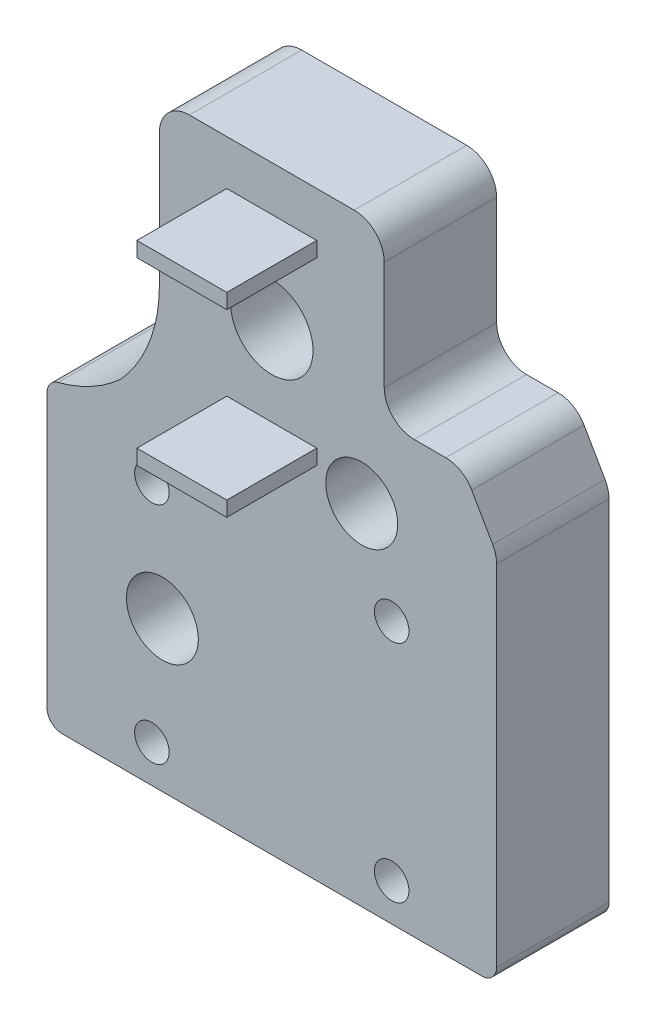
from build123d import *

# Parameters (mm, degrees)
SKETCH_1_W                   = 30
SKETCH_1_H                   = 20
EXTRUDE_1_DEPTH              = 7.5
SKETCH_5_W                   = 15
SKETCH_5_H                   = 7.5
EXTRUDE_2_DEPTH              = 17.5
SKETCH_6_W                   = 6
SKETCH_6_H                   = 1
EXTRUDE_3_DEPTH              = 6
HOLE_WIZARD_M6_1_D           = 5.5
HOLE_WIZARD_M6_1_CSINK_D     = 11.5
HOLE_WIZARD_M6_1_CSINK_ANGLE = 90
F_4_0MM_1_D                  = 4.8
F_4_0MM_1_DEPTH              = 7.5
F_4_0MM_1_TIP                = 1.442065486
EXTRUDE_4_DEPTH              = 7.5
F_4_0MM_2_D                  = 4.8
EXTRUDE_5_DEPTH              = 7.5
FILLET_1_R                   = 10
MOVE_BODY_1_OUTLINE_R        = 2.4
MOVE_BODY_1_OUTLINE_W        = 6
MOVE_BODY_1_OUTLINE_H        = 1
MOVE_BODY_1_OUTLINE_R_2      = 2.75
MOVE_BODY_1_DEPTH            = 7.5
MOVE_START                   = 6
MOVE_BODY_1_2_OUTLINE_W      = 6
MOVE_BODY_1_2_OUTLINE_H      = 1
MOVE_BODY_1_2_DEPTH          = 1.5
MOVE_START_2                 = -6.1500001
MOVE_BODY_1_3_OUTLINE_R      = 1.65
MOVE_BODY_1_3_OUTLINE_R_2    = 2.4
MOVE_BODY_1_3_OUTLINE_R_3    = 2.75
MOVE_BODY_1_3_DEPTH          = 6.1500001
MOVE_START_3                 = -7.5
MOVE_BODY_1_4_DEPTH          = 1.5
MOVE_BODY_1_5_OUTLINE_R      = 2.4
MOVE_BODY_1_5_OUTLINE_R_2    = 2.75
MOVE_BODY_1_5_DEPTH          = 1.3499999
MOVE_START_4                 = -0.3000001
MOVE_BODY_1_6_OUTLINE_R      = 2.4
MOVE_BODY_1_6_OUTLINE_R_2    = 2.75
MOVE_BODY_1_6_DEPTH          = 0.3000001
SKETCH_28_W                  = 15
SKETCH_28_H                  = 7.5
EXTRUDE_6_DEPTH              = 2.5
CUT_EXTRUDE_START            = -8
CUT_EXTRUDE_1_DEPTH          = 9
CUT_EXTRUDE_START_2          = -1
CUT_EXTRUDE_1_2_OUTLINE_R    = 2.5
CUT_EXTRUDE_1_2_OUTLINE_R_2  = 2.4
CUT_EXTRUDE_1_2_DEPTH        = 2


with BuildPart() as part:
    # 草图1 → 凸台-拉伸1 (new body)
    with BuildSketch(Plane.XY):
        Rectangle(SKETCH_1_W, SKETCH_1_H)
    extrude(amount=EXTRUDE_1_DEPTH)

    # 草图5 → 凸台-拉伸2 (add)
    with BuildSketch(Plane(origin=(0, 10, 0), x_dir=(1, 0, 0), z_dir=(0, 1, 0))):
        with Locations((0, -3.75)):
            Rectangle(SKETCH_5_W, SKETCH_5_H)
    extrude(amount=EXTRUDE_2_DEPTH)

    # 草图6 → 凸台-拉伸3 (add)
    with BuildSketch(Plane(origin=(0, 0, 0), x_dir=(-1, 0, 0), z_dir=(0, 0, -1))):
        with Locations((0, 26.5)):
            Rectangle(SKETCH_6_W, SKETCH_6_H)
        with Locations((0, 14.5)):
            Rectangle(SKETCH_6_W, SKETCH_6_H)
    extrude(amount=EXTRUDE_3_DEPTH)

    # M6 内六角花形半沉头螺钉的锥形沉头孔1 (through all)
    with Locations(Plane.XY.offset(7.5)):
        with Locations((0, 20.5)):
            CounterSinkHole(HOLE_WIZARD_M6_1_D / 2, HOLE_WIZARD_M6_1_CSINK_D / 2, counter_sink_angle=HOLE_WIZARD_M6_1_CSINK_ANGLE)

    # Ø4.0mm 暗销孔1
    with Locations(Plane.XY.offset(7.5)):
        with Locations((-7.3, 0)):
            Hole(F_4_0MM_1_D / 2, depth=F_4_0MM_1_DEPTH)
            with Locations((0, 0, -(F_4_0MM_1_DEPTH + F_4_0MM_1_TIP / 2))):  # 118° drill point
                Cone(0, F_4_0MM_1_D / 2, F_4_0MM_1_TIP, mode=Mode.SUBTRACT)

    # 草图15 → 凸台-拉伸4 (add)
    with BuildSketch(Plane.XY.offset(7.5)):
        Polygon((7.5, 18.75), (12.762776139, 18.75), (15, 14.845537246), (15, 10), (7.5, 10), align=None)
    extrude(amount=-EXTRUDE_4_DEPTH)

    # Ø4.0mm 暗销孔2 (through all)
    with Locations(Plane.XY.offset(7.5)):
        with Locations((6, 13.3)):
            Hole(F_4_0MM_2_D / 2)

    # 草图23 → 凸台-拉伸5 (add)
    with BuildSketch(Plane.XY.offset(7.5)):
        Polygon((-7.5, 15), (-12.5, 10), (-7.5, 10), align=None)
    extrude(amount=-EXTRUDE_5_DEPTH)

    # M6 内六角花形半沉头螺钉的锥形沉头孔3: read off the stored shape, not the designer's step
    # M6 内六角花形半沉头螺钉的锥形沉头孔3 outline → M6 内六角花形半沉头螺钉的锥形沉头孔3 (revolve, cut)
    with BuildSketch(Plane(origin=(-8, 7.5, 0), x_dir=(1, 0, 0), z_dir=(0, -1, 0))):
        Polygon((0, 7.5), (0, 0), (1.150716155, 0), (1.65, 0.3), (1.65, 6.15), (3, 7.5), align=None)
    hole_wizard_m6_3 = revolve(axis=Axis((-8, 7.5, 0), (0, 0, 1)), mode=Mode.SUBTRACT)

    # 镜向3: M6 内六角花形半沉头螺钉的锥形沉头孔3 across plane
    add(hole_wizard_m6_3.mirror(Plane.ZX), mode=Mode.SUBTRACT)

    # 镜向3 at the second plane: M6 内六角花形半沉头螺钉的锥形沉头孔3 across plane
    add(hole_wizard_m6_3.mirror(Plane(origin=(0, 0, 0), x_dir=(0, 0, 1), z_dir=(1, 0, 0))), mode=Mode.SUBTRACT)

    # 镜向3 at the second plane copy 1 sket → 镜向3 at the second plane copy 1 (revolve, cut)
    with BuildSketch(Plane(origin=(8, -7.5, 0), x_dir=(-1, 0, 0), z_dir=(0, 1, 0))):
        Polygon((0, 7.5), (0, 0), (1.150716155, 0), (1.65, 0.3), (1.65, 6.15), (3, 7.5), align=None)
    revolve(axis=Axis((8, -7.5, 0), (0, 0, 1)), mode=Mode.SUBTRACT)

    # 圆角1
    # the kernel refuses this fillet: 10 mm, written as the material it adds along each edge
    with BuildSketch(Plane(origin=(-12.5, 10, 7.5), x_dir=(-1, 0, 0), z_dir=(0, 0, -1))) as fillet_1_piece_1:
        with BuildLine():
            CenterArc((4.306697434, 9.83543819), FILLET_1_R, 225, 34.591227114)
            Line((-2.764370378, 2.764370378), (-2.905791734, 2.622949022))
            Line((-2.905791734, 2.622949022), (-0.141421356, -0.141421356))
            Line((-0.141421356, -0.141421356), (0, -0.2))
            ThreePointArc((0, -0.2), (1.25, -0.2), (2.463866051, -0.196708764))
            Line((2.463866051, -0.196708764), (2.5, 0))
        make_face()
    extrude(amount=7.5)
    with BuildSketch(Plane(origin=(-7.5, 15, 7.5), x_dir=(-0.7071067811865475, -0.7071067811865477, 0), z_dir=(0, 0, -1))) as fillet_1_piece_2:
        with BuildLine():
            CenterArc((FILLET_1_R * 0.414213562373, FILLET_1_R), FILLET_1_R, 225, 45)
            Line((-FILLET_1_R * 0.292893218813, FILLET_1_R * 0.292893218813), (-FILLET_1_R * 0.307035354437, FILLET_1_R * 0.27875108319))
            Line((-FILLET_1_R * 0.307035354437, FILLET_1_R * 0.27875108319), (-FILLET_1_R * 0.00828427124746, -FILLET_1_R * 0.02))
            Line((-FILLET_1_R * 0.00828427124746, -FILLET_1_R * 0.02), (FILLET_1_R * 0.414213562373, -FILLET_1_R * 0.02))
            Line((FILLET_1_R * 0.414213562373, -FILLET_1_R * 0.02), (FILLET_1_R * 0.414213562373, 0))
        make_face()
    extrude(amount=7.5)

    # Move Body 1: read off the stored shape, not the designer's step
    # Move Body 1 outline → Move Body 1 (cut)
    with BuildSketch(Plane.XY):
        with BuildLine():
            Line((-15, -10), (15, -10))
            Line((15, -10), (15, 14.845537246))
            Line((15, 14.845537246), (14.73531678, 15.307469462))
            Line((14.73531678, 15.307469462), (13.33902122, 17.744321716))
            Line((13.33902122, 17.744321716), (12.762776139, 18.75))
            Line((12.762776139, 18.75), (7.5, 18.75))
            Line((7.5, 18.75), (7.5, 27.5))
            Line((7.5, 27.5), (-7.5, 27.5))
            Line((-7.5, 27.5), (-7.5, 19.142135624))
            ThreePointArc((-7.5, 19.142135624), (-8.170150889, 15.542980782), (-10.090783115, 12.426221304))
            ThreePointArc((-10.090783115, 12.426221304), (-12.037200533, 11.046132226), (-14.255154312, 10.166434741))
            ThreePointArc((-14.255154312, 10.166434741), (-14.625988761, 10.076108823), (-15, 10))
            Line((-15, 10), (-15, -10))
        make_face()
        with Locations((-7.3, 0)):
            Circle(MOVE_BODY_1_OUTLINE_R, mode=Mode.SUBTRACT)
        with Locations((6, 13.3)):
            Circle(MOVE_BODY_1_OUTLINE_R, mode=Mode.SUBTRACT)
        with Locations((0, 14.5)):
            Rectangle(MOVE_BODY_1_OUTLINE_W, MOVE_BODY_1_OUTLINE_H, mode=Mode.SUBTRACT)
        with Locations((0, 20.5)):
            Circle(MOVE_BODY_1_OUTLINE_R_2, mode=Mode.SUBTRACT)
        with Locations((0, 26.5)):
            Rectangle(MOVE_BODY_1_OUTLINE_W, MOVE_BODY_1_OUTLINE_H, mode=Mode.SUBTRACT)
    extrude(amount=MOVE_BODY_1_DEPTH, mode=Mode.SUBTRACT)

    # Move Body 1 2 outline → Move Body 1 2 (cut)
    with BuildSketch(Plane.XY.offset(MOVE_START)):
        with Locations((0, 14.5)):
            Rectangle(MOVE_BODY_1_2_OUTLINE_W, MOVE_BODY_1_2_OUTLINE_H)
        with Locations((0, 26.5)):
            Rectangle(MOVE_BODY_1_2_OUTLINE_W, MOVE_BODY_1_2_OUTLINE_H)
    extrude(amount=MOVE_BODY_1_2_DEPTH, mode=Mode.SUBTRACT)

    # Move Body 1 3 outline → Move Body 1 3 (add)
    with BuildSketch(Plane.XY.offset(MOVE_START_2)):
        with BuildLine():
            Line((-15, 9.199534396), (-15, -9))
            ThreePointArc((-15, -9), (-14.707106781, -9.707106781), (-14, -10))
            Line((-14, -10), (14, -10))
            ThreePointArc((14, -10), (14.707106781, -9.707106781), (15, -9))
            Line((15, -9), (15, 14.313147746))
            ThreePointArc((15, 14.313147746), (14.932696763, 14.827621477), (14.73531678, 15.307469462))
            Line((14.73531678, 15.307469462), (13.33902122, 17.744321716))
            ThreePointArc((13.33902122, 17.744321716), (12.606539563, 18.480410852), (11.60370444, 18.75))
            Line((11.60370444, 18.75), (9.5, 18.75))
            ThreePointArc((9.5, 18.75), (8.085786438, 19.335786438), (7.5, 20.75))
            Line((7.5, 20.75), (7.5, 27.5))
            Line((7.5, 27.5), (-7.5, 27.5))
            Line((-7.5, 27.5), (-7.5, 19.142135624))
            ThreePointArc((-7.5, 19.142135624), (-8.170150889, 15.542980782), (-10.090783115, 12.426221304))
            ThreePointArc((-10.090783115, 12.426221304), (-12.037200533, 11.046132226), (-14.255154312, 10.166434741))
            ThreePointArc((-14.255154312, 10.166434741), (-14.792197675, 9.809798965), (-15, 9.199534396))
        make_face()
        with Locations((-8, -7.5)):
            Circle(MOVE_BODY_1_3_OUTLINE_R, mode=Mode.SUBTRACT)
        with Locations((-8, 7.5)):
            Circle(MOVE_BODY_1_3_OUTLINE_R, mode=Mode.SUBTRACT)
        with Locations((-7.3, 0)):
            Circle(MOVE_BODY_1_3_OUTLINE_R_2, mode=Mode.SUBTRACT)
        with Locations((8, -7.5)):
            Circle(MOVE_BODY_1_3_OUTLINE_R, mode=Mode.SUBTRACT)
        with Locations((8, 7.5)):
            Circle(MOVE_BODY_1_3_OUTLINE_R, mode=Mode.SUBTRACT)
        with Locations((6, 13.3)):
            Circle(MOVE_BODY_1_3_OUTLINE_R_2, mode=Mode.SUBTRACT)
        with Locations((0, 20.5)):
            Circle(MOVE_BODY_1_3_OUTLINE_R_3, mode=Mode.SUBTRACT)
    extrude(amount=MOVE_BODY_1_3_DEPTH)

    # Move Body 1 4 outline → Move Body 1 4 (add)
    with BuildSketch(Plane.XY.offset(MOVE_START_3)):
        with BuildLine():
            ThreePointArc((9.5, 18.75), (8.085786438, 19.335786438), (7.5, 20.75))
            Line((7.5, 20.75), (7.5, 18.75))
            Line((7.5, 18.75), (9.5, 18.75))
        make_face()
    extrude(amount=MOVE_BODY_1_4_DEPTH)

    # Move Body 1 5 outline → Move Body 1 5 (add)
    with BuildSketch(Plane.XY.offset(MOVE_START_3)):
        with BuildLine():
            Line((-15, 9.199534396), (-15, -9))
            ThreePointArc((-15, -9), (-14.707106781, -9.707106781), (-14, -10))
            Line((-14, -10), (14, -10))
            ThreePointArc((14, -10), (14.707106781, -9.707106781), (15, -9))
            Line((15, -9), (15, 14.313147746))
            ThreePointArc((15, 14.313147746), (14.932696763, 14.827621477), (14.73531678, 15.307469462))
            Line((14.73531678, 15.307469462), (13.33902122, 17.744321716))
            ThreePointArc((13.33902122, 17.744321716), (12.606539563, 18.480410852), (11.60370444, 18.75))
            Line((11.60370444, 18.75), (7.5, 18.75))
            Line((7.5, 18.75), (7.5, 27.5))
            Line((7.5, 27.5), (-7.5, 27.5))
            Line((-7.5, 27.5), (-7.5, 19.142135624))
            ThreePointArc((-7.5, 19.142135624), (-8.170150889, 15.542980782), (-10.090783115, 12.426221304))
            ThreePointArc((-10.090783115, 12.426221304), (-12.037200533, 11.046132226), (-14.255154312, 10.166434741))
            ThreePointArc((-14.255154312, 10.166434741), (-14.792197675, 9.809798965), (-15, 9.199534396))
        make_face()
        with Locations((-7.3, 0)):
            Circle(MOVE_BODY_1_5_OUTLINE_R, mode=Mode.SUBTRACT)
        with Locations((6, 13.3)):
            Circle(MOVE_BODY_1_5_OUTLINE_R, mode=Mode.SUBTRACT)
        with Locations((0, 20.5)):
            Circle(MOVE_BODY_1_5_OUTLINE_R_2, mode=Mode.SUBTRACT)
    extrude(amount=MOVE_BODY_1_5_DEPTH)

    # Move Body 1 6 outline → Move Body 1 6 (add)
    with BuildSketch(Plane.XY.offset(MOVE_START_4)):
        with BuildLine():
            Line((-15, 9.199534396), (-15, -9))
            ThreePointArc((-15, -9), (-14.707106781, -9.707106781), (-14, -10))
            Line((-14, -10), (14, -10))
            ThreePointArc((14, -10), (14.707106781, -9.707106781), (15, -9))
            Line((15, -9), (15, 14.313147746))
            ThreePointArc((15, 14.313147746), (14.932696763, 14.827621477), (14.73531678, 15.307469462))
            Line((14.73531678, 15.307469462), (13.33902122, 17.744321716))
            ThreePointArc((13.33902122, 17.744321716), (12.606539563, 18.480410852), (11.60370444, 18.75))
            Line((11.60370444, 18.75), (7.5, 18.75))
            Line((7.5, 18.75), (7.5, 27.5))
            Line((7.5, 27.5), (-7.5, 27.5))
            Line((-7.5, 27.5), (-7.5, 19.142135624))
            ThreePointArc((-7.5, 19.142135624), (-8.170150889, 15.542980782), (-10.090783115, 12.426221304))
            ThreePointArc((-10.090783115, 12.426221304), (-12.037200533, 11.046132226), (-14.255154312, 10.166434741))
            ThreePointArc((-14.255154312, 10.166434741), (-14.792197675, 9.809798965), (-15, 9.199534396))
        make_face()
        with Locations((-7.3, 0)):
            Circle(MOVE_BODY_1_6_OUTLINE_R, mode=Mode.SUBTRACT)
        with Locations((6, 13.3)):
            Circle(MOVE_BODY_1_6_OUTLINE_R, mode=Mode.SUBTRACT)
        with Locations((0, 20.5)):
            Circle(MOVE_BODY_1_6_OUTLINE_R_2, mode=Mode.SUBTRACT)
    extrude(amount=MOVE_BODY_1_6_DEPTH)

    # Move Body 1 7: loft between two sections, ruled curve by curve
    move_body_1_7_from = [
        Edge.make_three_point_arc((2.75, 20.5, -4.5), (0, 17.75, -4.5), (-2.75, 20.5, -4.5)),
        Edge.make_three_point_arc((-2.75, 20.5, -4.5), (0, 23.25, -4.5), (2.75, 20.5, -4.5)),
    ]
    move_body_1_7_to = [
        Edge.make_three_point_arc((5.75, 20.5, -7.5), (0, 14.75, -7.5), (-5.75, 20.5, -7.5)),
        Edge.make_three_point_arc((-5.75, 20.5, -7.5), (0, 26.25, -7.5), (5.75, 20.5, -7.5)),
    ]
    move_body_1_7 = Solid(Shell([*[Face.make_surface_from_curves(move_body_1_7_from[k], move_body_1_7_to[k]) for k in range(2)], Face(Wire(move_body_1_7_from)), Face(Wire(move_body_1_7_to))]))
    add(move_body_1_7, mode=Mode.SUBTRACT)

    # Move Body 1 8: loft between two sections, ruled curve by curve
    move_body_1_8_from = [
        Edge.make_three_point_arc((-6.849283845, 7.5, 0), (-8, 6.349283845, 0), (-9.150716155, 7.5, 0)),
        Edge.make_three_point_arc((-9.150716155, 7.5, 0), (-8, 8.650716155, 0), (-6.849283845, 7.5, 0)),
    ]
    move_body_1_8_to = [
        Edge.make_three_point_arc((-6.35, 7.5, -0.3), (-8, 5.85, -0.3), (-9.65, 7.5, -0.3)),
        Edge.make_three_point_arc((-9.65, 7.5, -0.3), (-8, 9.15, -0.3), (-6.35, 7.5, -0.3)),
    ]
    move_body_1_8 = Solid(Shell([*[Face.make_surface_from_curves(move_body_1_8_from[k], move_body_1_8_to[k]) for k in range(2)], Face(Wire(move_body_1_8_from)), Face(Wire(move_body_1_8_to))]))
    add(move_body_1_8, mode=Mode.SUBTRACT)

    # Move Body 1 9: loft between two sections, ruled curve by curve
    move_body_1_9_from = [
        Edge.make_three_point_arc((-6.35, 7.5, -6.15), (-8, 5.85, -6.15), (-9.65, 7.5, -6.15)),
        Edge.make_three_point_arc((-9.65, 7.5, -6.15), (-8, 9.15, -6.15), (-6.35, 7.5, -6.15)),
    ]
    move_body_1_9_to = [
        Edge.make_three_point_arc((-5, 7.5, -7.5), (-8, 4.5, -7.5), (-11, 7.5, -7.5)),
        Edge.make_three_point_arc((-11, 7.5, -7.5), (-8, 10.5, -7.5), (-5, 7.5, -7.5)),
    ]
    move_body_1_9 = Solid(Shell([*[Face.make_surface_from_curves(move_body_1_9_from[k], move_body_1_9_to[k]) for k in range(2)], Face(Wire(move_body_1_9_from)), Face(Wire(move_body_1_9_to))]))
    add(move_body_1_9, mode=Mode.SUBTRACT)

    # Move Body 1 10: loft between two sections, ruled curve by curve
    move_body_1_10_from = [
        Edge.make_three_point_arc((9.150716155, 7.5, 0), (8, 6.349283845, 0), (6.849283845, 7.5, 0)),
        Edge.make_three_point_arc((6.849283845, 7.5, 0), (8, 8.650716155, 0), (9.150716155, 7.5, 0)),
    ]
    move_body_1_10_to = [
        Edge.make_three_point_arc((9.65, 7.5, -0.3), (8, 5.85, -0.3), (6.35, 7.5, -0.3)),
        Edge.make_three_point_arc((6.35, 7.5, -0.3), (8, 9.15, -0.3), (9.65, 7.5, -0.3)),
    ]
    move_body_1_10 = Solid(Shell([*[Face.make_surface_from_curves(move_body_1_10_from[k], move_body_1_10_to[k]) for k in range(2)], Face(Wire(move_body_1_10_from)), Face(Wire(move_body_1_10_to))]))
    add(move_body_1_10, mode=Mode.SUBTRACT)

    # Move Body 1 11: loft between two sections, ruled curve by curve
    move_body_1_11_from = [
        Edge.make_three_point_arc((9.65, 7.5, -6.15), (8, 5.85, -6.15), (6.35, 7.5, -6.15)),
        Edge.make_three_point_arc((6.35, 7.5, -6.15), (8, 9.15, -6.15), (9.65, 7.5, -6.15)),
    ]
    move_body_1_11_to = [
        Edge.make_three_point_arc((11, 7.5, -7.5), (8, 4.5, -7.5), (5, 7.5, -7.5)),
        Edge.make_three_point_arc((5, 7.5, -7.5), (8, 10.5, -7.5), (11, 7.5, -7.5)),
    ]
    move_body_1_11 = Solid(Shell([*[Face.make_surface_from_curves(move_body_1_11_from[k], move_body_1_11_to[k]) for k in range(2)], Face(Wire(move_body_1_11_from)), Face(Wire(move_body_1_11_to))]))
    add(move_body_1_11, mode=Mode.SUBTRACT)

    # Move Body 1 12: loft between two sections, ruled curve by curve
    move_body_1_12_from = [
        Edge.make_three_point_arc((-6.849283845, -7.5, 0), (-8, -8.650716155, 0), (-9.150716155, -7.5, 0)),
        Edge.make_three_point_arc((-9.150716155, -7.5, 0), (-8, -6.349283845, 0), (-6.849283845, -7.5, 0)),
    ]
    move_body_1_12_to = [
        Edge.make_three_point_arc((-6.35, -7.5, -0.3), (-8, -9.15, -0.3), (-9.65, -7.5, -0.3)),
        Edge.make_three_point_arc((-9.65, -7.5, -0.3), (-8, -5.85, -0.3), (-6.35, -7.5, -0.3)),
    ]
    move_body_1_12 = Solid(Shell([*[Face.make_surface_from_curves(move_body_1_12_from[k], move_body_1_12_to[k]) for k in range(2)], Face(Wire(move_body_1_12_from)), Face(Wire(move_body_1_12_to))]))
    add(move_body_1_12, mode=Mode.SUBTRACT)

    # Move Body 1 13: loft between two sections, ruled curve by curve
    move_body_1_13_from = [
        Edge.make_three_point_arc((-6.35, -7.5, -6.15), (-8, -9.15, -6.15), (-9.65, -7.5, -6.15)),
        Edge.make_three_point_arc((-9.65, -7.5, -6.15), (-8, -5.85, -6.15), (-6.35, -7.5, -6.15)),
    ]
    move_body_1_13_to = [
        Edge.make_three_point_arc((-5, -7.5, -7.5), (-8, -10.5, -7.5), (-11, -7.5, -7.5)),
        Edge.make_three_point_arc((-11, -7.5, -7.5), (-8, -4.5, -7.5), (-5, -7.5, -7.5)),
    ]
    move_body_1_13 = Solid(Shell([*[Face.make_surface_from_curves(move_body_1_13_from[k], move_body_1_13_to[k]) for k in range(2)], Face(Wire(move_body_1_13_from)), Face(Wire(move_body_1_13_to))]))
    add(move_body_1_13, mode=Mode.SUBTRACT)

    # Move Body 1 14: loft between two sections, ruled curve by curve
    move_body_1_14_from = [
        Edge.make_three_point_arc((9.150716155, -7.5, 0), (8, -8.650716155, 0), (6.849283845, -7.5, 0)),
        Edge.make_three_point_arc((6.849283845, -7.5, 0), (8, -6.349283845, 0), (9.150716155, -7.5, 0)),
    ]
    move_body_1_14_to = [
        Edge.make_three_point_arc((9.65, -7.5, -0.3), (8, -9.15, -0.3), (6.35, -7.5, -0.3)),
        Edge.make_three_point_arc((6.35, -7.5, -0.3), (8, -5.85, -0.3), (9.65, -7.5, -0.3)),
    ]
    move_body_1_14 = Solid(Shell([*[Face.make_surface_from_curves(move_body_1_14_from[k], move_body_1_14_to[k]) for k in range(2)], Face(Wire(move_body_1_14_from)), Face(Wire(move_body_1_14_to))]))
    add(move_body_1_14, mode=Mode.SUBTRACT)

    # Move Body 1 15: loft between two sections, ruled curve by curve
    move_body_1_15_from = [
        Edge.make_three_point_arc((9.65, -7.5, -6.15), (8, -9.15, -6.15), (6.35, -7.5, -6.15)),
        Edge.make_three_point_arc((6.35, -7.5, -6.15), (8, -5.85, -6.15), (9.65, -7.5, -6.15)),
    ]
    move_body_1_15_to = [
        Edge.make_three_point_arc((11, -7.5, -7.5), (8, -10.5, -7.5), (5, -7.5, -7.5)),
        Edge.make_three_point_arc((5, -7.5, -7.5), (8, -4.5, -7.5), (11, -7.5, -7.5)),
    ]
    move_body_1_15 = Solid(Shell([*[Face.make_surface_from_curves(move_body_1_15_from[k], move_body_1_15_to[k]) for k in range(2)], Face(Wire(move_body_1_15_from)), Face(Wire(move_body_1_15_to))]))
    add(move_body_1_15, mode=Mode.SUBTRACT)

    # 草图28 → 凸台-拉伸6 (add)
    with BuildSketch(Plane(origin=(0, 27.5, 0), x_dir=(1, 0, 0), z_dir=(0, 1, 0))):
        with Locations((0, 3.75)):
            Rectangle(SKETCH_28_W, SKETCH_28_H)
    extrude(amount=EXTRUDE_6_DEPTH)

    # 切除-拉伸1: read off the stored shape, not the designer's step
    # 切除-拉伸1 outline → 切除-拉伸1 (cut)
    with BuildSketch(Plane(origin=(0, 0, -7.5), x_dir=(-1, 0, 0), z_dir=(0, 0, -1)).offset(CUT_EXTRUDE_START)):
        with BuildLine():
            Line((-7.5, 30), (-7.5, 28))
            ThreePointArc((-7.5, 28), (-6.914213562, 29.414213562), (-5.5, 30))
            Line((-5.5, 30), (-7.5, 30))
        make_face()
        with BuildLine():
            Line((7.5, 30), (5.5, 30))
            ThreePointArc((5.5, 30), (6.914213562, 29.414213562), (7.5, 28))
            Line((7.5, 28), (7.5, 30))
        make_face()
    extrude(amount=CUT_EXTRUDE_1_DEPTH, mode=Mode.SUBTRACT)

    # Cut-Extrude 1 2 outline → Cut-Extrude 1 2 (cut)
    # profile 1 of 2: a face of its own
    with BuildSketch(Plane(origin=(0, 0, -7.5), x_dir=(-1, 0, 0), z_dir=(0, 0, -1)).offset(CUT_EXTRUDE_START_2)):
        with Locations((-6, 13.3)):
            Circle(CUT_EXTRUDE_1_2_OUTLINE_R)
        with Locations((-6, 13.3)):
            Circle(CUT_EXTRUDE_1_2_OUTLINE_R_2, mode=Mode.SUBTRACT)
    # profile 2 of 2: a face of its own
    with BuildSketch(Plane(origin=(0, 0, -7.5), x_dir=(-1, 0, 0), z_dir=(0, 0, -1)).offset(CUT_EXTRUDE_START_2)):
        with Locations((7.3, 0)):
            Circle(CUT_EXTRUDE_1_2_OUTLINE_R)
        with Locations((7.3, 0)):
            Circle(CUT_EXTRUDE_1_2_OUTLINE_R_2, mode=Mode.SUBTRACT)
    extrude(amount=CUT_EXTRUDE_1_2_DEPTH, mode=Mode.SUBTRACT)


solid = part.part
